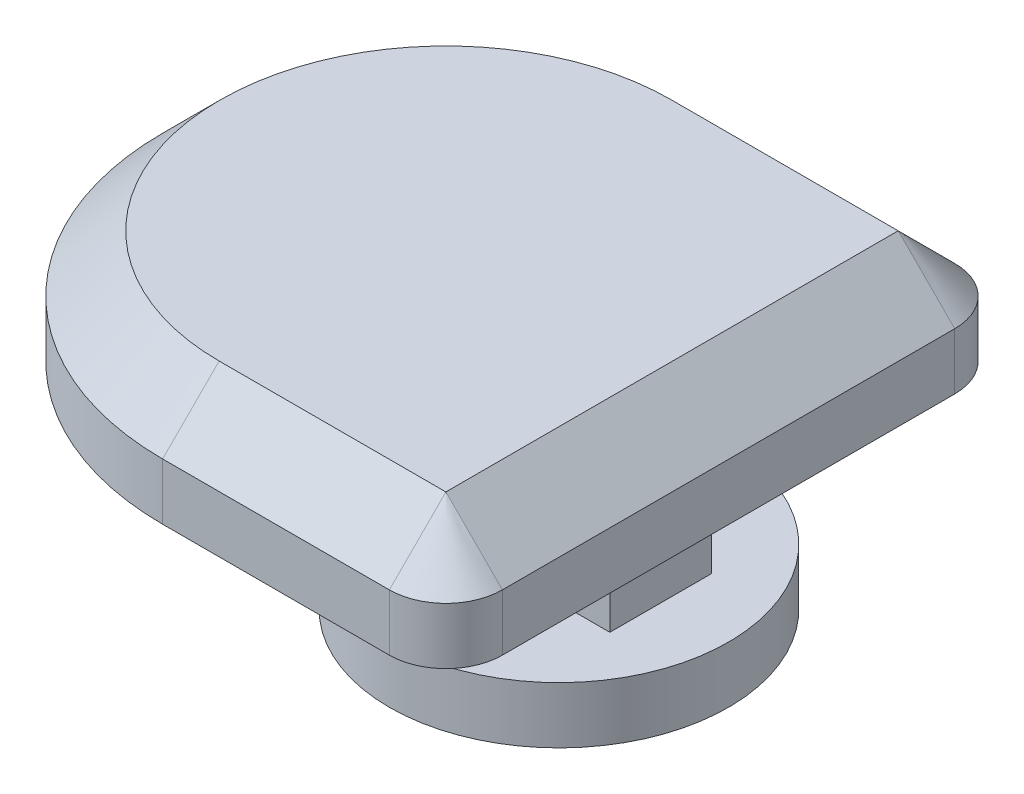
from build123d import *

# Parameters (mm, degrees)
SKETCH_1_R      = 3
EXTRUDE_1_DEPTH = 1
SKETCH_2_W      = 3.6
SKETCH_2_H      = 1.8
EXTRUDE_2_DEPTH = 1.8
EXTRUDE_3_DEPTH = 2
CHAMFER_1_SIZE  = 1


with BuildPart() as part:
    # 草图1 → 凸台-拉伸1 (new body)
    with BuildSketch(Plane(origin=(0, 0, 0), x_dir=(1, 0, 0), z_dir=(0, 1, 0))):
        with Locations(Location((0, 0, 0), (0, 0, 270))):
            Circle(SKETCH_1_R)
    extrude(amount=EXTRUDE_1_DEPTH)

    # 草图2 → 凸台-拉伸2 (add)
    with BuildSketch(Plane(origin=(0, 1, 0), x_dir=(1, 0, 0), z_dir=(0, 1, 0))):
        Rectangle(SKETCH_2_W, SKETCH_2_H)
    extrude(amount=EXTRUDE_2_DEPTH)

    # 草图3 → 凸台-拉伸3 (add)
    with BuildSketch(Plane(origin=(0, 2.8, 0), x_dir=(1, 0, 0), z_dir=(0, 1, 0))):
        with BuildLine():
            Line((2, 5), (-2.01, 5))
            ThreePointArc((-2.01, 5), (-5.538462838, 3.538462838), (-7, 0.01))
            Line((-7, 0.01), (-7, -0.01))
            ThreePointArc((-7, -0.01), (-5.538462838, -3.538462838), (-2.01, -5))
            Line((-2.01, -5), (2, -5))
            ThreePointArc((2, -5), (2.707106781, -4.707106781), (3, -4))
            Line((3, -4), (3, 4))
            ThreePointArc((3, 4), (2.707106781, 4.707106781), (2, 5))
        make_face()
    extrude(amount=EXTRUDE_3_DEPTH)

    # 倒角1
    chamfer_1_edges = [part.edges().sort_by_distance(p)[0] for p in [
        (-5.538462838, 4.8, 3.538462838),
        (-0.005, 4.8, 5),
        (2.707106781, 4.8, 4.707106781),
        (3, 4.8, 0),
        (2.707106781, 4.8, -4.707106781),
        (-0.005, 4.8, -5),
        (-5.538462838, 4.8, -3.538462838),
        (-7, 4.8, 0),
    ]]
    chamfer(chamfer_1_edges, length=CHAMFER_1_SIZE - 0.0001)  # a hair under: the kernel refuses the full size


solid = part.part
